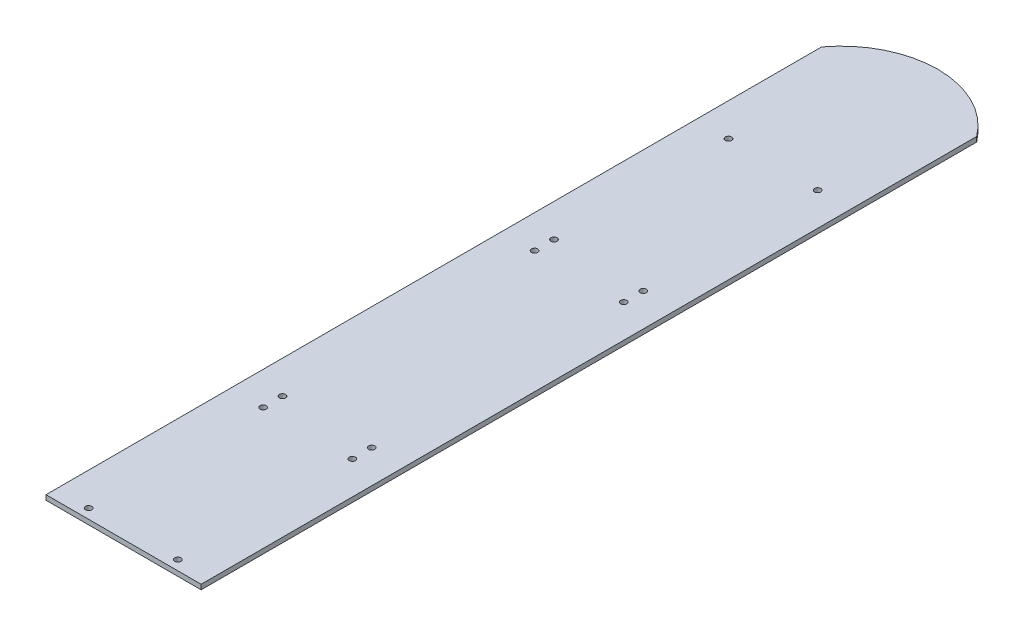
from build123d import *

# Parameters (mm, degrees)
BOSS_EXTRUDE1_DEPTH = 3.175
SKETCH2_R           = 2.032
CUT_EXTRUDE1_DEPTH  = 519.070111689


with BuildPart() as part:
    # Sketch1 → Boss-Extrude1 (new body)
    with BuildSketch(Plane(origin=(0, 0, 0), x_dir=(1, 0, 0), z_dir=(0, 1, 0))):
        with BuildLine():
            Line((0, 0), (0, -508))
            Line((0, -508), (101.6, -508))
            Line((101.6, -508), (101.6, 0))
            ThreePointArc((101.6, 0), (50.8, 25.4), (0, 0))
        make_face()
    extrude(amount=BOSS_EXTRUDE1_DEPTH)

    # Sketch2 → Cut-Extrude1 (cut, through all)
    with BuildSketch(Plane.XZ):
        with Locations((21.59, 501.65)):
            Circle(SKETCH2_R)
        with Locations((80.01, 501.65)):
            Circle(SKETCH2_R)
        with Locations((21.59, 82.55)):
            Circle(SKETCH2_R)
        with Locations((80.01, 82.55)):
            Circle(SKETCH2_R)
        with Locations((21.59, 209.55)):
            Circle(SKETCH2_R)
        with Locations((80.01, 209.55)):
            Circle(SKETCH2_R)
        with Locations((21.59, 196.85)):
            Circle(SKETCH2_R)
        with Locations((80.01, 196.85)):
            Circle(SKETCH2_R)
        with Locations((21.59, 374.65)):
            Circle(SKETCH2_R)
        with Locations((80.01, 374.65)):
            Circle(SKETCH2_R)
        with Locations((21.59, 387.35)):
            Circle(SKETCH2_R)
        with Locations((80.01, 387.35)):
            Circle(SKETCH2_R)
    extrude(amount=-CUT_EXTRUDE1_DEPTH, mode=Mode.SUBTRACT)


solid = part.part
